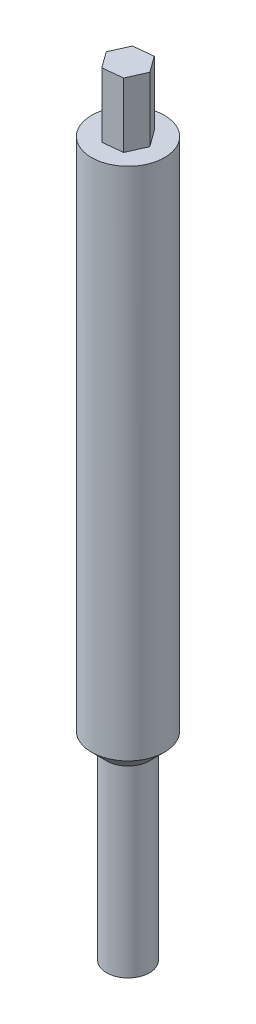
from build123d import *

# Parameters (mm, degrees)
SKETCH1_R           = 6.35
BOSS_EXTRUDE1_DEPTH = 421.64
SKETCH2_R           = 10.795
BOSS_EXTRUDE2_DEPTH = 421.64
SKETCH3_R           = 25.4
SKETCH3_R_2         = 6.35
CUT_EXTRUDE1_DEPTH  = 52.324
CUT_EXTRUDE2_START  = -57.658
SKETCH4_R           = 25.4
SKETCH4_R_2         = 6.35
CUT_EXTRUDE2_DEPTH  = 57.658
CHAMFER1_SIZE       = 6.35
SKETCH5_R           = 15.875
CUT_EXTRUDE4_DEPTH  = 212.372033273
BOSS_EXTRUDE3_DEPTH = 19.05


with BuildPart() as part:
    # Sketch1 → Boss-Extrude1 (new body)
    with BuildSketch(Plane(origin=(0, 0, 0), x_dir=(1, 0, 0), z_dir=(0, 1, 0))):
        with Locations(Location((0, 0, 0), (0, 0, 270))):
            Circle(SKETCH1_R)
    extrude(amount=BOSS_EXTRUDE1_DEPTH)

    # Sketch2 → Boss-Extrude2 (add)
    with BuildSketch(Plane(origin=(0, 0, 0), x_dir=(-1, 0, 0), z_dir=(0, -1, 0))):
        with Locations(Location((0, 0, 0), (0, 0, 90))):
            Circle(SKETCH2_R)
    extrude(amount=-BOSS_EXTRUDE2_DEPTH)

    # Sketch3 → Cut-Extrude1 (cut)
    with BuildSketch(Plane.XZ):
        Circle(SKETCH3_R)
        with Locations(Location((0, 0, 0), (0, 0, 270))):
            Circle(SKETCH3_R_2, mode=Mode.SUBTRACT)
    extrude(amount=-CUT_EXTRUDE1_DEPTH, mode=Mode.SUBTRACT)

    # Sketch4 → Cut-Extrude2 (cut)
    with BuildSketch(Plane(origin=(0, 421.64, 0), x_dir=(1, 0, 0), z_dir=(0, 1, 0)).offset(CUT_EXTRUDE2_START)):
        Circle(SKETCH4_R)
        with Locations(Location((0, 0, 0), (0, 0, 90))):
            Circle(SKETCH4_R_2, mode=Mode.SUBTRACT)
    extrude(amount=CUT_EXTRUDE2_DEPTH, mode=Mode.SUBTRACT)

    # Chamfer1
    # the kernel refuses this chamfer: 6.35 mm, written as the material it takes off along each edge
    with BuildSketch(Plane(origin=(0, 52.324, 0), x_dir=(0, 0, -1), z_dir=(-1, 0, 0))) as chamfer1_piece_1_section:
        Polygon((10.795, -CHAMFER1_SIZE), (10.795 - CHAMFER1_SIZE, 0), (10.795, 0), align=None)
    chamfer1_piece_1 = revolve(axis=Axis((0, 52.324, 0), (0, -1, 0)), mode=Mode.PRIVATE)
    chamfer1_piece_1 = chamfer1_piece_1 - Plane(origin=(0, 56.4676015, 0), x_dir=(0, 0, -1), z_dir=(0, -1, 0)) * Cylinder(6.35, 44, mode=Mode.PRIVATE)
    add(chamfer1_piece_1, mode=Mode.SUBTRACT)
    with BuildSketch(Plane(origin=(0, 363.982, 0), x_dir=(0, 0, -1), z_dir=(-1, 0, 0))) as chamfer1_piece_2_section:
        Polygon((10.795, CHAMFER1_SIZE), (10.795 - CHAMFER1_SIZE, 0), (10.795, 0), align=None)
    chamfer1_piece_2 = revolve(axis=Axis((0, 363.982, 0), (0, -1, 0)), mode=Mode.PRIVATE)
    chamfer1_piece_2 = chamfer1_piece_2 - Plane(origin=(0, 359.8383985, 0), x_dir=(0, 0, -1), z_dir=(0, -1, 0)) * Cylinder(6.35, 44, mode=Mode.PRIVATE)
    add(chamfer1_piece_2, mode=Mode.SUBTRACT)

    # Sketch5 → Cut-Extrude4 (cut, through all)
    with BuildSketch(Plane(origin=(0, 210.82, 0), x_dir=(1, 0, 0), z_dir=(0, 1, 0))):
        Circle(SKETCH5_R)
    extrude(amount=CUT_EXTRUDE4_DEPTH, mode=Mode.SUBTRACT)

    # Sketch6 → Boss-Extrude3 (add)
    with BuildSketch(Plane(origin=(0, 210.82, 0), x_dir=(1, 0, 0), z_dir=(0, 1, 0))):
        Polygon((-3.436763353, 4.753650281), (-5.83516358, -0.59949923), (-2.398400227, -5.353149511), (3.436763353, -4.753650281), (5.83516358, 0.59949923), (2.398400227, 5.353149511), align=None)
    extrude(amount=BOSS_EXTRUDE3_DEPTH)


solid = part.part
